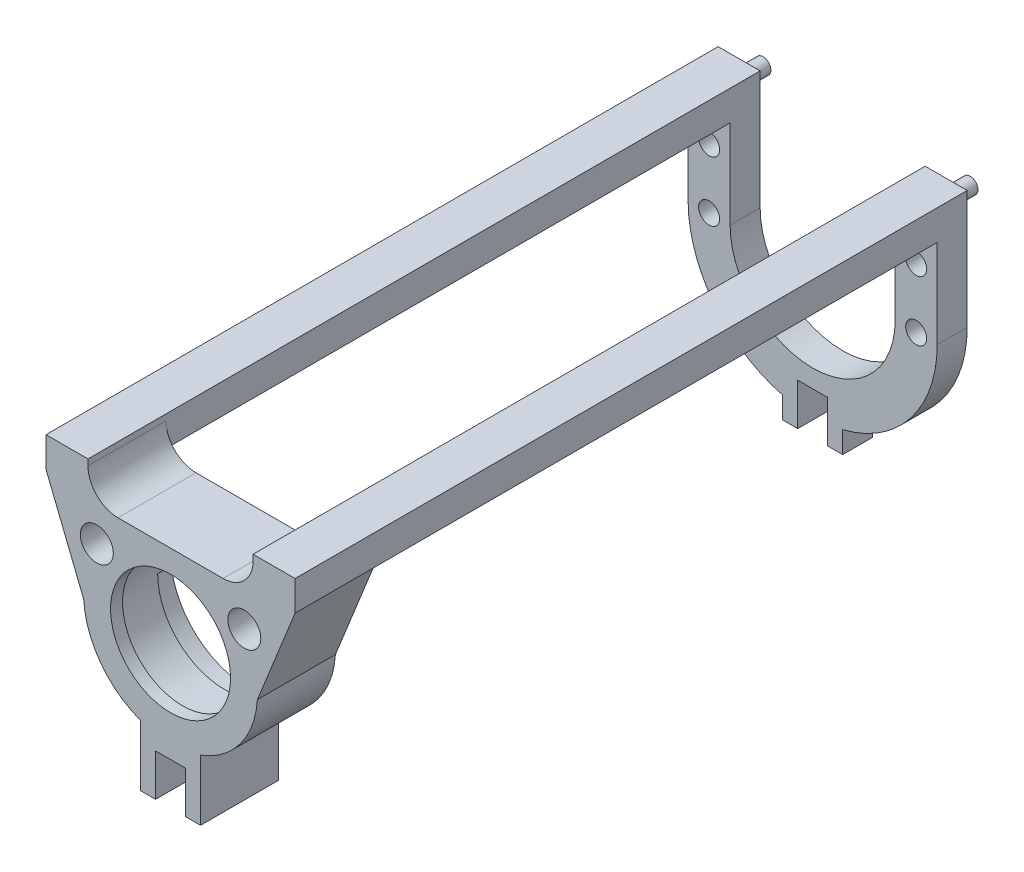
from build123d import *
from build123d.topology import SkipClean

# Parameters (mm, degrees)
SKETCH2_R            = 1.75
BOSS_EXTRUDE1_DEPTH  = 5
SKETCH3_R            = 1.3
BOSS_EXTRUDE2_DEPTH  = 4
SKETCH4_W            = 7
SKETCH4_H            = 5
BOSS_EXTRUDE3_DEPTH  = 107
BOSS_EXTRUDE4_START  = -2
SKETCH5_R            = 13.753194099
SKETCH5_R_2          = 10
SKETCH5_W            = 7
SKETCH5_H            = 5
BOSS_EXTRUDE4_DEPTH  = 2
BOSS_EXTRUDE5_START  = 10
SKETCH6_R            = 11.15
BOSS_EXTRUDE5_DEPTH  = 10
CUT_EXTRUDE1_START   = -3
SKETCH7_R            = 13
CUT_EXTRUDE1_DEPTH   = 3
BOSS_EXTRUDE6_DEPTH  = 3
BOSS_EXTRUDE7_DEPTH  = 1
BOSS_EXTRUDE8_START  = -2
BOSS_EXTRUDE8_DEPTH  = 2
FILLET1_R            = 5
BOSS_EXTRUDE9_START  = -13
BOSS_EXTRUDE9_DEPTH  = 13
FILLET3_R            = 5
SKETCH13_R           = 2.75
CUT_EXTRUDE2_DEPTH   = 15
BOSS_EXTRUDE10_DEPTH = 13


with BuildPart() as part:
    # Sketch2 → Boss-Extrude1 (new body)
    with BuildSketch(Plane.XY):
        with BuildLine():
            Line((-2.5, -23.753194099), (-2.5, -16.753194099))
            Line((-2.5, -16.753194099), (2.5, -16.753194099))
            Line((2.5, -16.753194099), (2.5, -23.753194099))
            Line((2.5, -23.753194099), (5, -23.753194099))
            Line((5, -23.753194099), (5, -20.141873431))
            ThreePointArc((5, -20.141873431), (16.34718685, -12.785325472), (20.753194099, 0))
            Line((20.753194099, 0), (20.753194099, 19.75))
            Line((20.753194099, 19.75), (13.753194099, 19.75))
            Line((13.753194099, 19.75), (13.753194099, 0))
            ThreePointArc((13.753194099, 0), (0, -13.753194099), (-13.753194099, 0))
            Line((-13.753194099, 0), (-13.753194099, 19.75))
            Line((-13.753194099, 19.75), (-20.753194099, 19.75))
            Line((-20.753194099, 19.75), (-20.753194099, 0))
            ThreePointArc((-20.753194099, 0), (-16.34718685, -12.785325472), (-5, -20.141873431))
            Line((-5, -20.141873431), (-5, -23.753194099))
            Line((-5, -23.753194099), (-2.5, -23.753194099))
        make_face()
        with Locations((17.253194099, 10)):
            Circle(SKETCH2_R, mode=Mode.SUBTRACT)
        with Locations((17.253194099, 0)):
            Circle(SKETCH2_R, mode=Mode.SUBTRACT)
        with Locations((-17.253194099, 0)):
            Circle(SKETCH2_R, mode=Mode.SUBTRACT)
        with Locations((-17.253194099, 10)):
            Circle(SKETCH2_R, mode=Mode.SUBTRACT)
    extrude(amount=BOSS_EXTRUDE1_DEPTH)

    # Sketch3 → Boss-Extrude2 (add)
    with BuildSketch(Plane(origin=(0, 0, 0), x_dir=(-1, 0, 0), z_dir=(0, 0, -1))):
        with Locations(Location((17.253194099, 16.75, 0), (0, 0, 180))):
            Circle(SKETCH3_R)
        with Locations(Location((-17.253194099, 16.75, 0), (0, 0, 180))):
            Circle(SKETCH3_R)
    extrude(amount=BOSS_EXTRUDE2_DEPTH)

    # Sketch4 → Boss-Extrude3 (add)
    with BuildSketch(Plane.XY.offset(5)):
        with Locations((-17.253194099, 17.25)):
            Rectangle(SKETCH4_W, SKETCH4_H)
        with Locations((17.253194099, 17.25)):
            Rectangle(SKETCH4_W, SKETCH4_H)
    extrude(amount=BOSS_EXTRUDE3_DEPTH)

    # Sketch5 → Boss-Extrude4 (add)
    # profile 1 of 6: a face of its own
    with BuildSketch(Plane.XY.offset(112).offset(BOSS_EXTRUDE4_START)):
        with BuildLine():
            Line((0, 13.753194099), (-13.753194099, 13.753194099))
            Line((-13.753194099, 13.753194099), (-13.753194099, 0))
            ThreePointArc((-13.753194099, 0), (-9.724976811, 9.724976811), (0, 13.753194099))
        make_face()
    # profile 2 of 6: a face of its own
    with BuildSketch(Plane.XY.offset(112).offset(BOSS_EXTRUDE4_START)):
        Circle(SKETCH5_R)
        Circle(SKETCH5_R_2, mode=Mode.SUBTRACT)
    # profile 3 of 6: a face of its own
    with BuildSketch(Plane.XY.offset(112).offset(BOSS_EXTRUDE4_START)):
        with BuildLine():
            Line((13.753194099, 14.75), (13.753194099, 13.753194099))
            Line((13.753194099, 13.753194099), (13.753194099, 0))
            ThreePointArc((13.753194099, 0), (13.502745228, -2.612703434), (12.76052008, -5.13025099))
            Line((12.76052008, -5.13025099), (20.753194099, 14.75))
            Line((20.753194099, 14.75), (13.753194099, 14.75))
        make_face()
    # profile 4 of 6: a face of its own
    with BuildSketch(Plane.XY.offset(112).offset(BOSS_EXTRUDE4_START)):
        with Locations((17.253194099, 17.25)):
            Rectangle(SKETCH5_W, SKETCH5_H)
    # profile 5 of 6: a face of its own
    with BuildSketch(Plane.XY.offset(112).offset(BOSS_EXTRUDE4_START)):
        with BuildLine():
            Line((13.753194099, 13.753194099), (0, 13.753194099))
            ThreePointArc((0, 13.753194099), (9.724976811, 9.724976811), (13.753194099, 0))
            Line((13.753194099, 0), (13.753194099, 13.753194099))
        make_face()
    # profile 6 of 6: a face of its own
    with BuildSketch(Plane.XY.offset(112).offset(BOSS_EXTRUDE4_START)):
        with BuildLine():
            Line((-13.753194099, 13.753194099), (-13.753194099, 19.75))
            Line((-13.753194099, 19.75), (-20.753194099, 19.75))
            Line((-20.753194099, 19.75), (-20.753194099, 14.75))
            Line((-20.753194099, 14.75), (-12.76052008, -5.13025099))
            ThreePointArc((-12.76052008, -5.13025099), (-13.502745228, -2.612703434), (-13.753194099, 0))
            Line((-13.753194099, 0), (-13.753194099, 13.753194099))
        make_face()
    extrude(amount=BOSS_EXTRUDE4_DEPTH)

    # Sketch6 → Boss-Extrude5 (add)
    # profile 1 of 3: a face of its own
    with BuildSketch(Plane(origin=(0, 0, 110), x_dir=(-1, 0, 0), z_dir=(0, 0, -1)).offset(BOSS_EXTRUDE5_START)):
        with BuildLine():
            ThreePointArc((13.753194099, 0), (13.502745228, -2.612703434), (12.76052008, -5.13025099))
            Line((12.76052008, -5.13025099), (20.753194099, 14.75))
            Line((20.753194099, 14.75), (13.753194099, 14.75))
            Line((13.753194099, 14.75), (13.753194099, 13.753194099))
            Line((13.753194099, 13.753194099), (0, 13.753194099))
            ThreePointArc((0, 13.753194099), (9.724976811, 9.724976811), (13.753194099, 0))
        make_face()
    # profile 2 of 3: a face of its own
    with BuildSketch(Plane(origin=(0, 0, 110), x_dir=(-1, 0, 0), z_dir=(0, 0, -1)).offset(BOSS_EXTRUDE5_START)):
        with BuildLine():
            Line((-20.753194099, 14.75), (-12.76052008, -5.13025099))
            ThreePointArc((-12.76052008, -5.13025099), (-11.395343031, 7.700422401), (0, 13.753194099))
            Line((0, 13.753194099), (-13.753194099, 13.753194099))
            Line((-13.753194099, 13.753194099), (-13.753194099, 14.75))
            Line((-13.753194099, 14.75), (-20.753194099, 14.75))
        make_face()
    # profile 3 of 3: a face of its own
    with BuildSketch(Plane(origin=(0, 0, 110), x_dir=(-1, 0, 0), z_dir=(0, 0, -1)).offset(BOSS_EXTRUDE5_START)):
        with BuildLine():
            ThreePointArc((-12.76052008, -5.13025099), (0, -13.753194099), (12.76052008, -5.13025099))
            ThreePointArc((12.76052008, -5.13025099), (13.502745228, -2.612703434), (13.753194099, 0))
            ThreePointArc((13.753194099, 0), (9.724976811, 9.724976811), (0, 13.753194099))
            ThreePointArc((0, 13.753194099), (-11.395343031, 7.700422401), (-12.76052008, -5.13025099))
        make_face()
        Circle(SKETCH6_R, mode=Mode.SUBTRACT)
    extrude(amount=-BOSS_EXTRUDE5_DEPTH)

    # Sketch7 → Cut-Extrude1 (cut)
    with BuildSketch(Plane(origin=(0, 0, 100), x_dir=(-1, 0, 0), z_dir=(0, 0, -1)).offset(CUT_EXTRUDE1_START)):
        Circle(SKETCH7_R)
    extrude(amount=CUT_EXTRUDE1_DEPTH, mode=Mode.SUBTRACT)

    # Sketch8 → Boss-Extrude6 (add)
    with SkipClean():  # the faces are left unmerged after this step: merging them gives an invalid solid
        with BuildSketch(Plane(origin=(0, 0, 103), x_dir=(-1, 0, 0), z_dir=(0, 0, -1))):
            with BuildLine():
                ThreePointArc((10.105331825, 4.712193618), (10.885700479, 2.413301695), (11.15, 0))
                Line((11.15, 0), (13, 0))
                ThreePointArc((13, 0), (12.691848093, 2.813714981), (11.782001231, 5.494037403))
                Line((11.782001231, 5.494037403), (10.105331825, 4.712193618))
            make_face()
            with BuildLine():
                ThreePointArc((-10.105331825, -4.712193618), (-10.885700479, -2.413301695), (-11.15, 0))
                Line((-11.15, 0), (-13, 0))
                ThreePointArc((-13, 0), (-12.691848093, -2.813714981), (-11.782001231, -5.494037403))
                Line((-11.782001231, -5.494037403), (-10.105331825, -4.712193618))
            make_face()
        extrude(amount=BOSS_EXTRUDE6_DEPTH)

    # Sketch9 → Boss-Extrude7 (add)
    with BuildSketch(Plane(origin=(0, 0, 100), x_dir=(-1, 0, 0), z_dir=(0, 0, -1))):
        with BuildLine():
            Line((13.753194099, 13.753194099), (-13.753194099, 13.753194099))
            Line((-13.753194099, 13.753194099), (-13.753194099, 14.75))
            Line((-13.753194099, 14.75), (-20.753194099, 14.75))
            Line((-20.753194099, 14.75), (-12.76052008, -5.13025099))
            ThreePointArc((-12.76052008, -5.13025099), (0, -13.753194099), (12.76052008, -5.13025099))
            Line((12.76052008, -5.13025099), (20.753194099, 14.75))
            Line((20.753194099, 14.75), (13.753194099, 14.75))
            Line((13.753194099, 14.75), (13.753194099, 13.753194099))
        make_face()
        with BuildLine():
            Line((-11.15, 0), (-13, 0))
            ThreePointArc((-13, 0), (-2.813714981, 12.691848093), (11.782001231, 5.494037403))
            Line((11.782001231, 5.494037403), (10.105331825, 4.712193618))
            ThreePointArc((10.105331825, 4.712193618), (10.885700479, 2.413301695), (11.15, 0))
            Line((11.15, 0), (13, 0))
            ThreePointArc((13, 0), (2.813714981, -12.691848093), (-11.782001231, -5.494037403))
            Line((-11.782001231, -5.494037403), (-10.105331825, -4.712193618))
            ThreePointArc((-10.105331825, -4.712193618), (-10.885700479, -2.413301695), (-11.15, 0))
        make_face(mode=Mode.SUBTRACT)
    extrude(amount=BOSS_EXTRUDE7_DEPTH)

    # Sketch10 → Boss-Extrude8 (add)
    with BuildSketch(Plane(origin=(0, 0, 99), x_dir=(-1, 0, 0), z_dir=(0, 0, -1)).offset(BOSS_EXTRUDE8_START)):
        with BuildLine():
            Line((0, 13), (0, 11.15))
            ThreePointArc((0, 11.15), (5.990890633, 9.403814621), (10.105331825, 4.712193618))
            Line((10.105331825, 4.712193618), (11.782001231, 5.494037403))
            ThreePointArc((11.782001231, 5.494037403), (6.984894909, 10.964088796), (0, 13))
        make_face()
        with BuildLine():
            Line((0, -13), (0, -11.15))
            ThreePointArc((0, -11.15), (-5.990890633, -9.403814621), (-10.105331825, -4.712193618))
            Line((-10.105331825, -4.712193618), (-11.782001231, -5.494037403))
            ThreePointArc((-11.782001231, -5.494037403), (-6.984894909, -10.964088796), (0, -13))
        make_face()
    extrude(amount=BOSS_EXTRUDE8_DEPTH)

    # Fillet1
    # the kernel refuses this fillet: 5 mm, written as the material it takes off along each edge
    with BuildSketch(Plane(origin=(0, -23, 101), x_dir=(0, 0, -1), z_dir=(0, 1, 0))) as fillet1_piece_1_section:
        with BuildLine():
            CenterArc((5, -4), FILLET1_R, 126.869897646, 53.130102354)
            Line((0, -4), (0, 0))
            Line((0, 0), (2, 0))
        make_face()
    fillet1_piece_1 = extrude(amount=21.85, mode=Mode.PRIVATE)
    fillet1_piece_1 = fillet1_piece_1 & Plane(origin=(0, 0, 100.481080227), x_dir=(-1, 0, 0), z_dir=(0, 0, 1)) * Cylinder(13, 60, mode=Mode.PRIVATE)
    add(fillet1_piece_1, mode=Mode.SUBTRACT)
    with BuildSketch(Plane(origin=(0, 23, 101), x_dir=(0, 0, -1), z_dir=(0, -1, 0))) as fillet1_piece_2_section:
        with BuildLine():
            CenterArc((5, -4), FILLET1_R, 126.869897646, 53.130102354)
            Line((0, -4), (0, 0))
            Line((0, 0), (2, 0))
        make_face()
    fillet1_piece_2 = extrude(amount=21.85, mode=Mode.PRIVATE)
    fillet1_piece_2 = fillet1_piece_2 & Plane(origin=(0, 0, 100.481080227), x_dir=(1, 0, 0), z_dir=(0, 0, 1)) * Cylinder(13, 60, mode=Mode.PRIVATE)
    add(fillet1_piece_2, mode=Mode.SUBTRACT)

    # Sketch11 → Boss-Extrude9 (add)
    with BuildSketch(Plane.XY.offset(112).offset(BOSS_EXTRUDE9_START)):
        with BuildLine():
            Line((2.5, -16.753194099), (2.5, -23.753194099))
            Line((2.5, -23.753194099), (5, -23.753194099))
            Line((5, -23.753194099), (5, -12.812117231))
            ThreePointArc((5, -12.812117231), (0, -13.753194099), (-5, -12.812117231))
            Line((-5, -12.812117231), (-5, -23.753194099))
            Line((-5, -23.753194099), (-2.5, -23.753194099))
            Line((-2.5, -23.753194099), (-2.5, -16.753194099))
            Line((-2.5, -16.753194099), (2.5, -16.753194099))
        make_face()
    extrude(amount=BOSS_EXTRUDE9_DEPTH)

    # Fillet3
    # the kernel refuses this fillet: 5 mm, written as the material it adds along each edge
    with BuildSketch(Plane(origin=(13.753194099, 13.753194099, 99), x_dir=(0, 1, 0), z_dir=(0, 0, 1)), Plane(origin=(-13.753194099, 13.753194099, 112), x_dir=(0, 1, 0), z_dir=(0, 0, -1))) as fillet3_piece_1:
        with BuildLine():
            CenterArc((FILLET3_R, FILLET3_R), FILLET3_R, 180, 90)
            Line((0, FILLET3_R), (0, 0))
            Line((0, 0), (FILLET3_R, 0))
        make_face()
    extrude(amount=13)

    # Sketch13 → Cut-Extrude2 (cut)
    with BuildSketch(Plane.XY.offset(112)):
        with Locations((-12.288728005, 8.217660193)):
            Circle(SKETCH13_R)
        with Locations((12.288728005, 8.217660193)):
            Circle(SKETCH13_R)
    extrude(amount=-CUT_EXTRUDE2_DEPTH, mode=Mode.SUBTRACT)

    # Sketch14 → Boss-Extrude10 (add)
    with BuildSketch(Plane(origin=(0, 0, 99), x_dir=(-1, 0, 0), z_dir=(0, 0, -1))):
        with BuildLine():
            ThreePointArc((5, -13.610657589), (11.636170752, -8.6515623), (14.473975018, -0.868358893))
            Line((14.473975018, -0.868358893), (12.76052008, -5.13025099))
            ThreePointArc((12.76052008, -5.13025099), (9.675318373, -9.774382964), (5, -12.812117231))
            Line((5, -12.812117231), (5, -13.610657589))
        make_face()
        with BuildLine():
            Line((-5, -12.812117231), (-5, -13.610657589))
            ThreePointArc((-5, -13.610657589), (0, -14.5), (5, -13.610657589))
            Line((5, -13.610657589), (5, -12.812117231))
            ThreePointArc((5, -12.812117231), (0, -13.753194099), (-5, -12.812117231))
        make_face()
        with BuildLine():
            Line((-12.76052008, -5.13025099), (-14.473975018, -0.868358893))
            ThreePointArc((-14.473975018, -0.868358893), (-11.636170752, -8.6515623), (-5, -13.610657589))
            Line((-5, -13.610657589), (-5, -12.812117231))
            ThreePointArc((-5, -12.812117231), (-9.675318373, -9.774382964), (-12.76052008, -5.13025099))
        make_face()
    extrude(amount=-BOSS_EXTRUDE10_DEPTH)


solid = part.part
